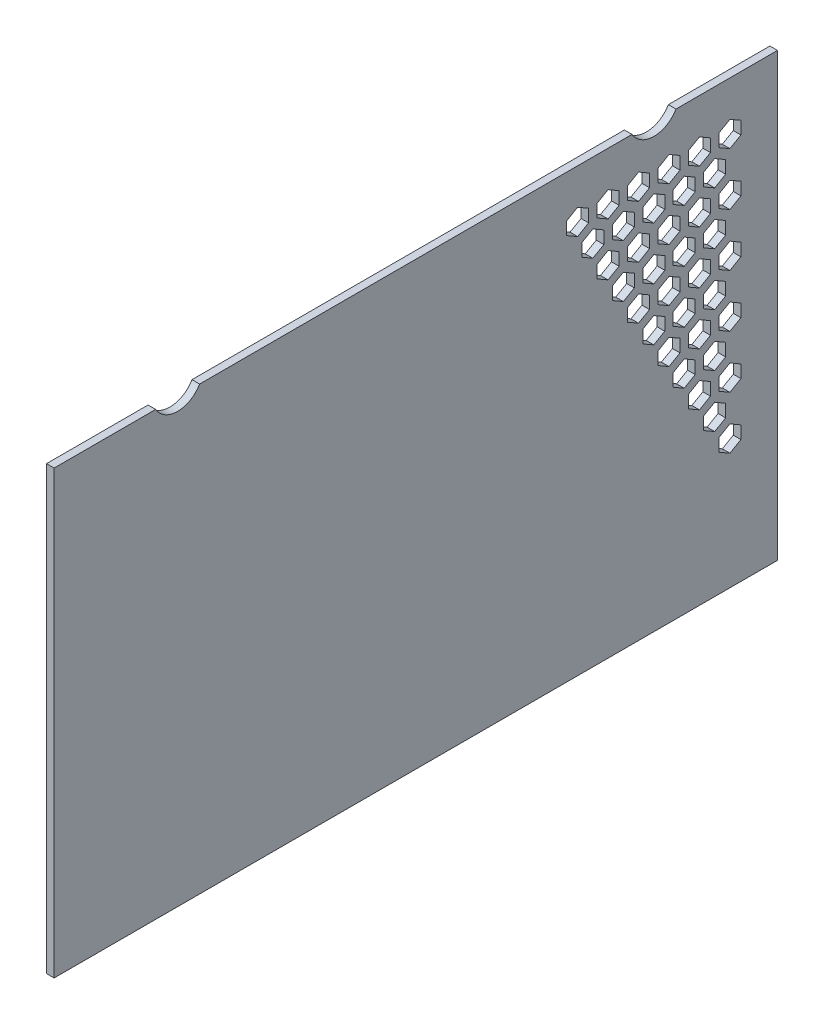
from build123d import *

# Parameters (mm, degrees)
SKICA1_W                      = 285
SKICA1_H                      = 175
P_IDAT_VYSUNUT_M1_DEPTH       = 3
P_IDAT_VYSUNUT_M2_DEPTH       = 10
POLE_VYPLN_N_M1_DEPTH         = 13
SKICA4_W                      = 131.901816579
SKICA4_H                      = 240.056617621
ODEBRAT_VYSUNUT_M3_DEPTH      = 335.692396089
ODEBRAT_VYSUNUT_M4_DEPTH      = 335.453285228
ODEBRAT_VYSUNUT_M4_DEPTH_BACK = 335.453285228


# Read off the part's stored shape, not the designer's step: Pole vyplněním1
with BuildPart() as part:
    # Skica1 → Přidat vysunutím1 (new body)
    with BuildSketch(Plane(origin=(0, 0, 0), x_dir=(0, 0, -1), z_dir=(1, 0, 0))):
        with Locations((142.5, 87.5)):
            Rectangle(SKICA1_W, SKICA1_H)
    extrude(amount=P_IDAT_VYSUNUT_M1_DEPTH)

    # Skica2 → Přidat vysunutím2 (add)
    with BuildSketch(Plane(origin=(3, 0, 0), x_dir=(0, 0, -1), z_dir=(1, 0, 0))):
        Polygon((275, 170), (275, 15), (185.510708276, 170), align=None)
    extrude(amount=P_IDAT_VYSUNUT_M2_DEPTH)

    # Pole vyplněním1 outline → Pole vyplněním1 (cut)
    with BuildSketch(Plane.YZ):
        Polygon((48.430780618, -261.925227119), (45.930780618, -266.255354138), (48.430780618, -270.585481157), (53.430780618, -270.585481157), (55.930780618, -266.255354138), (53.430780618, -261.925227119), align=None)
        Polygon((69.215390309, -270.585481157), (74.215390309, -270.585481157), (76.715390309, -266.255354138), (74.215390309, -261.925227119), (69.215390309, -261.925227119), (66.715390309, -266.255354138), align=None)
        Polygon((90, -270.585481157), (95, -270.585481157), (97.5, -266.255354138), (95, -261.925227119), (90, -261.925227119), (87.5, -266.255354138), align=None)
        Polygon((110.784609691, -270.585481157), (115.784609691, -270.585481157), (118.284609691, -266.255354138), (115.784609691, -261.925227119), (110.784609691, -261.925227119), (108.284609691, -266.255354138), align=None)
        Polygon((131.569219382, -270.585481157), (136.569219382, -270.585481157), (139.069219382, -266.255354138), (136.569219382, -261.925227119), (131.569219382, -261.925227119), (129.069219382, -266.255354138), align=None)
        Polygon((152.353829072, -270.585481157), (157.353829072, -270.585481157), (159.853829072, -266.255354138), (157.353829072, -261.925227119), (152.353829072, -261.925227119), (149.853829072, -266.255354138), align=None)
        Polygon((79.607695155, -243.925227119), (77.107695155, -248.255354138), (79.607695155, -252.585481157), (84.607695155, -252.585481157), (87.107695155, -248.255354138), (84.607695155, -243.925227119), align=None)
        Polygon((58.823085464, -255.925227119), (56.323085464, -260.255354138), (58.823085464, -264.585481157), (63.823085464, -264.585481157), (66.323085464, -260.255354138), (63.823085464, -255.925227119), align=None)
        Polygon((79.607695155, -264.585481157), (84.607695155, -264.585481157), (87.107695155, -260.255354138), (84.607695155, -255.925227119), (79.607695155, -255.925227119), (77.107695155, -260.255354138), align=None)
        Polygon((100.392304845, -264.585481157), (105.392304845, -264.585481157), (107.892304845, -260.255354138), (105.392304845, -255.925227119), (100.392304845, -255.925227119), (97.892304845, -260.255354138), align=None)
        Polygon((121.176914536, -264.585481157), (126.176914536, -264.585481157), (128.676914536, -260.255354138), (126.176914536, -255.925227119), (121.176914536, -255.925227119), (118.676914536, -260.255354138), align=None)
        Polygon((141.961524227, -264.585481157), (146.961524227, -264.585481157), (149.461524227, -260.255354138), (146.961524227, -255.925227119), (141.961524227, -255.925227119), (139.461524227, -260.255354138), align=None)
        Polygon((100.392304845, -243.925227119), (97.892304845, -248.255354138), (100.392304845, -252.585481157), (105.392304845, -252.585481157), (107.892304845, -248.255354138), (105.392304845, -243.925227119), align=None)
        Polygon((110.784609691, -225.925227119), (108.284609691, -230.255354138), (110.784609691, -234.585481157), (115.784609691, -234.585481157), (118.284609691, -230.255354138), (115.784609691, -225.925227119), align=None)
        Polygon((141.961524227, -207.925227119), (139.461524227, -212.255354138), (141.961524227, -216.585481157), (146.961524227, -216.585481157), (149.461524227, -212.255354138), (146.961524227, -207.925227119), align=None)
        Polygon((131.569219382, -225.925227119), (129.069219382, -230.255354138), (131.569219382, -234.585481157), (136.569219382, -234.585481157), (139.069219382, -230.255354138), (136.569219382, -225.925227119), align=None)
        Polygon((121.176914536, -243.925227119), (118.676914536, -248.255354138), (121.176914536, -252.585481157), (126.176914536, -252.585481157), (128.676914536, -248.255354138), (126.176914536, -243.925227119), align=None)
        Polygon((152.353829072, -225.925227119), (149.853829072, -230.255354138), (152.353829072, -234.585481157), (157.353829072, -234.585481157), (159.853829072, -230.255354138), (157.353829072, -225.925227119), align=None)
        Polygon((141.961524227, -243.925227119), (139.461524227, -248.255354138), (141.961524227, -252.585481157), (146.961524227, -252.585481157), (149.461524227, -248.255354138), (146.961524227, -243.925227119), align=None)
        Polygon((152.353829072, -249.925227119), (149.853829072, -254.255354138), (152.353829072, -258.585481157), (157.353829072, -258.585481157), (159.853829072, -254.255354138), (157.353829072, -249.925227119), align=None)
        Polygon((139.461524227, -236.255354138), (141.961524227, -240.585481157), (146.961524227, -240.585481157), (149.461524227, -236.255354138), (146.961524227, -231.925227119), (141.961524227, -231.925227119), align=None)
        Polygon((129.069219382, -218.255354138), (131.569219382, -222.585481157), (136.569219382, -222.585481157), (139.069219382, -218.255354138), (136.569219382, -213.925227119), (131.569219382, -213.925227119), align=None)
        Polygon((69.215390309, -258.585481157), (74.215390309, -258.585481157), (76.715390309, -254.255354138), (74.215390309, -249.925227119), (69.215390309, -249.925227119), (66.715390309, -254.255354138), align=None)
        Polygon((90, -258.585481157), (95, -258.585481157), (97.5, -254.255354138), (95, -249.925227119), (90, -249.925227119), (87.5, -254.255354138), align=None)
        Polygon((110.784609691, -258.585481157), (115.784609691, -258.585481157), (118.284609691, -254.255354138), (115.784609691, -249.925227119), (110.784609691, -249.925227119), (108.284609691, -254.255354138), align=None)
        Polygon((131.569219382, -258.585481157), (136.569219382, -258.585481157), (139.069219382, -254.255354138), (136.569219382, -249.925227119), (131.569219382, -249.925227119), (129.069219382, -254.255354138), align=None)
        Polygon((152.353829072, -237.925227119), (149.853829072, -242.255354138), (152.353829072, -246.585481157), (157.353829072, -246.585481157), (159.853829072, -242.255354138), (157.353829072, -237.925227119), align=None)
        Polygon((139.461524227, -224.255354138), (141.961524227, -228.585481157), (146.961524227, -228.585481157), (149.461524227, -224.255354138), (146.961524227, -219.925227119), (141.961524227, -219.925227119), align=None)
        Polygon((131.569219382, -246.585481157), (136.569219382, -246.585481157), (139.069219382, -242.255354138), (136.569219382, -237.925227119), (131.569219382, -237.925227119), (129.069219382, -242.255354138), align=None)
        Polygon((90, -246.585481157), (95, -246.585481157), (97.5, -242.255354138), (95, -237.925227119), (90, -237.925227119), (87.5, -242.255354138), align=None)
        Polygon((110.784609691, -246.585481157), (115.784609691, -246.585481157), (118.284609691, -242.255354138), (115.784609691, -237.925227119), (110.784609691, -237.925227119), (108.284609691, -242.255354138), align=None)
        Polygon((152.353829072, -213.925227119), (149.853829072, -218.255354138), (152.353829072, -222.585481157), (157.353829072, -222.585481157), (159.853829072, -218.255354138), (157.353829072, -213.925227119), align=None)
        Polygon((152.353829072, -201.925227119), (149.853829072, -206.255354138), (152.353829072, -210.585481157), (157.353829072, -210.585481157), (159.853829072, -206.255354138), (157.353829072, -201.925227119), align=None)
        Polygon((121.176914536, -219.925227119), (118.676914536, -224.255354138), (121.176914536, -228.585481157), (126.176914536, -228.585481157), (128.676914536, -224.255354138), (126.176914536, -219.925227119), align=None)
        Polygon((121.176914536, -240.585481157), (126.176914536, -240.585481157), (128.676914536, -236.255354138), (126.176914536, -231.925227119), (121.176914536, -231.925227119), (118.676914536, -236.255354138), align=None)
        Polygon((100.392304845, -240.585481157), (105.392304845, -240.585481157), (107.892304845, -236.255354138), (105.392304845, -231.925227119), (100.392304845, -231.925227119), (97.892304845, -236.255354138), align=None)
    extrude(amount=POLE_VYPLN_N_M1_DEPTH, mode=Mode.SUBTRACT)

    # Skica4 → Odebrat vysunutím3 (cut, through all)
    with BuildSketch(Plane(origin=(0, 0, 0), x_dir=(1, 0, 0), z_dir=(0, 1, 0))):
        with Locations((68.95090829, 164.97169119)):
            Rectangle(SKICA4_W, SKICA4_H)
    extrude(amount=ODEBRAT_VYSUNUT_M3_DEPTH, mode=Mode.SUBTRACT)

    # Skica5 → Odebrat vysunutím4 (cut, two sides: drawn at the far end of the back side and taken through both)
    with BuildSketch(Plane(origin=(0, 0, 0), x_dir=(0, 0, -1), z_dir=(1, 0, 0)).offset(-ODEBRAT_VYSUNUT_M4_DEPTH_BACK)):
        with BuildLine():
            Line((-677.83530904, 174), (0, 174))
            Line((0, 174), (40, 174))
            ThreePointArc((40, 174), (48.660254038, 169), (57.320508076, 174))
            Line((57.320508076, 174), (227.679491924, 174))
            ThreePointArc((227.679491924, 174), (236.339745962, 169), (245, 174))
            Line((245, 174), (285, 174))
            Line((285, 174), (962.83530904, 174))
            Line((962.83530904, 174), (962.83530904, 1529.670618079))
            Line((962.83530904, 1529.670618079), (-677.83530904, 1529.670618079))
            Line((-677.83530904, 1529.670618079), (-677.83530904, 174))
        make_face()
    extrude(amount=ODEBRAT_VYSUNUT_M4_DEPTH + ODEBRAT_VYSUNUT_M4_DEPTH_BACK, mode=Mode.SUBTRACT)


solid = part.part
